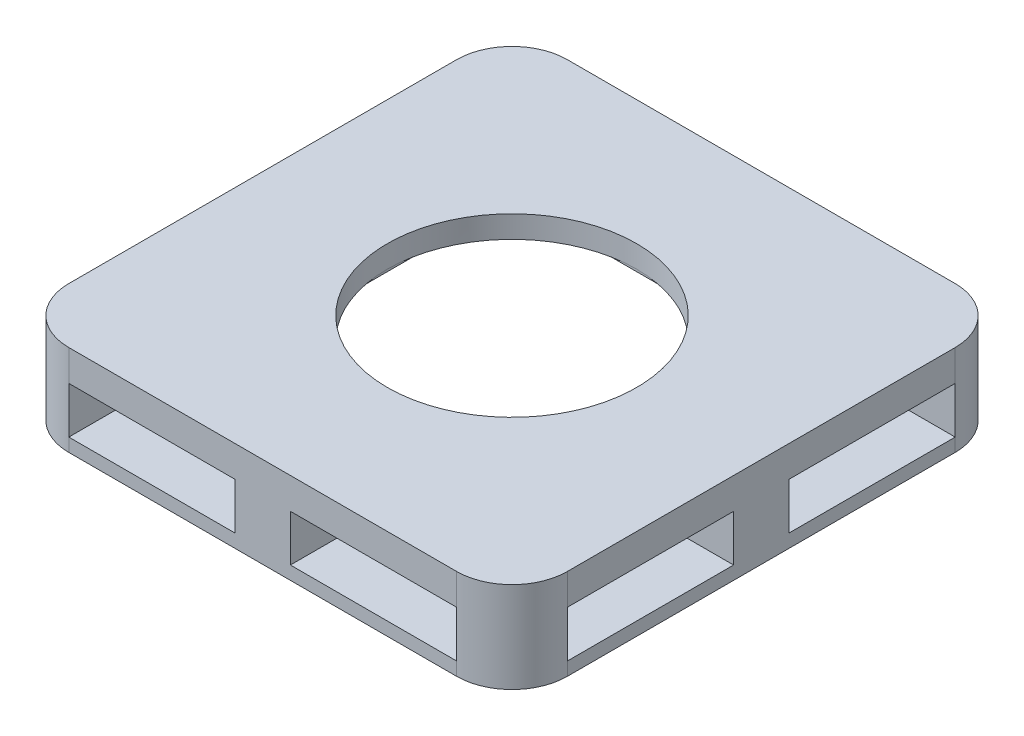
from build123d import *

# Parameters (mm, degrees)
ESBO_O1_W                = 45
ESBO_O1_H                = 45
BASE_DEPTH               = 1.2
ESBO_O2_W                = 5
ESBO_O2_H                = 5
PAREDES_DEPTH            = 5
ESBO_O3_W                = 45
ESBO_O3_H                = 45
TELHADO_DEPTH            = 2
CORTE_DA_BASE_DEPTH      = 2
ESBO_O5_R                = 11.25
CORTE_DO_C_RCULO_DEPTH   = 2
PONTE_1_REACH            = 48.621
ESBO_O6_W                = 5
ESBO_O6_H                = 0.8
PONTE_2_REACH            = 48.621
ESBO_O7_W                = 5
ESBO_O7_H                = 0.8
RESSALTO_EXTRUS_O6_DEPTH = 0.4
RESSALTO_EXTRUS_O7_DEPTH = 0.2
FILETE1_R                = 5
FILETE2_R                = 5
FILETE3_R                = 5
FILETE4_R                = 5


with BuildPart() as part:
    # Esboço1 → Base (new body)
    with BuildSketch(Plane(origin=(0, 0, 0), x_dir=(1, 0, 0), z_dir=(0, 1, 0))):
        Rectangle(ESBO_O1_W, ESBO_O1_H)
    extrude(amount=BASE_DEPTH)

    # Esboço2 → Paredes (add)
    with BuildSketch(Plane(origin=(0, 1.2, 0), x_dir=(1, 0, 0), z_dir=(0, 1, 0))):
        with Locations((-20, 20)):
            Rectangle(ESBO_O2_W, ESBO_O2_H)
        with Locations((20, 20)):
            Rectangle(ESBO_O2_W, ESBO_O2_H)
        with Locations((20, -20)):
            Rectangle(ESBO_O2_W, ESBO_O2_H)
        with Locations((-20, -20)):
            Rectangle(ESBO_O2_W, ESBO_O2_H)
        with Locations((0, 20)):
            Rectangle(ESBO_O2_W, ESBO_O2_H)
        with Locations((-20, 0)):
            Rectangle(ESBO_O2_W, ESBO_O2_H)
        with Locations((20, 0)):
            Rectangle(ESBO_O2_W, ESBO_O2_H)
        with Locations((0, -20)):
            Rectangle(ESBO_O2_W, ESBO_O2_H)
    extrude(amount=PAREDES_DEPTH)

    # Esboço3 → Telhado (add)
    with BuildSketch(Plane(origin=(0, 6.2, 0), x_dir=(1, 0, 0), z_dir=(0, 1, 0))):
        Rectangle(ESBO_O3_W, ESBO_O3_H)
    extrude(amount=TELHADO_DEPTH)

    # Esboço4 → Corte da Base (cut)
    with BuildSketch(Plane(origin=(0, 1.2, 0), x_dir=(1, 0, 0), z_dir=(0, 1, 0))):
        with BuildLine():
            Line((-12.5, 17.5), (12.5, 17.5))
            ThreePointArc((12.5, 17.5), (16.035533906, 16.035533906), (17.5, 12.5))
            Line((17.5, 12.5), (17.5, -12.5))
            ThreePointArc((17.5, -12.5), (16.035533906, -16.035533906), (12.5, -17.5))
            Line((12.5, -17.5), (-12.5, -17.5))
            ThreePointArc((-12.5, -17.5), (-16.035533906, -16.035533906), (-17.5, -12.5))
            Line((-17.5, -12.5), (-17.5, 12.5))
            ThreePointArc((-17.5, 12.5), (-16.035533906, 16.035533906), (-12.5, 17.5))
        make_face()
    extrude(amount=-CORTE_DA_BASE_DEPTH, mode=Mode.SUBTRACT)

    # Esboço5 → Corte do Círculo (cut)
    with BuildSketch(Plane.XZ.offset(-6.2)):
        with Locations(Location((0, 0, 0), (0, 0, 270))):
            Circle(ESBO_O5_R)
    extrude(amount=-CORTE_DO_C_RCULO_DEPTH, mode=Mode.SUBTRACT)

    # Esboço6 → Ponte 1 (add, up to next)
    with BuildSketch(Plane.XY.offset(-17.5), mode=Mode.PRIVATE) as ponte_1_sk1:
        with Locations((20, 5.8)):
            Rectangle(ESBO_O6_W, ESBO_O6_H)
    ponte_1_tool1 = extrude(ponte_1_sk1.sketch, amount=PONTE_1_REACH, mode=Mode.PRIVATE) - part.part
    # Esboço6 → Ponte 1 (add, up to next)
    with BuildSketch(Plane.XY.offset(-17.5), mode=Mode.PRIVATE) as ponte_1_sk2:
        with Locations((-20, 5.8)):
            Rectangle(ESBO_O6_W, ESBO_O6_H)
    ponte_1_tool2 = extrude(ponte_1_sk2.sketch, amount=PONTE_1_REACH, mode=Mode.PRIVATE) - part.part
    add(ponte_1_tool1.solids().sort_by_distance((20, 5.8, -17.5))[0])
    add(ponte_1_tool1.solids().sort_by_distance((20, 5.8, -17.5))[1])
    add(ponte_1_tool2.solids().sort_by_distance((-20, 5.8, -17.5))[0])
    add(ponte_1_tool2.solids().sort_by_distance((-20, 5.8, -17.5))[1])

    # Esboço7 → Ponte 2 (add, up to next)
    with BuildSketch(Plane.ZY.offset(-17.5), mode=Mode.PRIVATE) as ponte_2_sk1:
        with Locations((20, 5.8)):
            Rectangle(ESBO_O7_W, ESBO_O7_H)
    ponte_2_tool1 = extrude(ponte_2_sk1.sketch, amount=PONTE_2_REACH, mode=Mode.PRIVATE) - part.part
    # Esboço7 → Ponte 2 (add, up to next)
    with BuildSketch(Plane.ZY.offset(-17.5), mode=Mode.PRIVATE) as ponte_2_sk2:
        with Locations((-20, 5.8)):
            Rectangle(ESBO_O7_W, ESBO_O7_H)
    ponte_2_tool2 = extrude(ponte_2_sk2.sketch, amount=PONTE_2_REACH, mode=Mode.PRIVATE) - part.part
    add(ponte_2_tool1.solids().sort_by_distance((17.5, 5.8, 20))[0])
    add(ponte_2_tool1.solids().sort_by_distance((17.5, 5.8, 20))[1])
    add(ponte_2_tool2.solids().sort_by_distance((17.5, 5.8, -20))[0])
    add(ponte_2_tool2.solids().sort_by_distance((17.5, 5.8, -20))[1])

    # Esboço8 → Ressalto-extrusão6 (add)
    with BuildSketch(Plane(origin=(0, 6.2, 0), x_dir=(-1, 0, 0), z_dir=(0, -1, 0))):
        Polygon((-2, -17.5), (-17.5, -2), (-17.5, -17.5), align=None)
        Polygon((-17.5, 2), (-17.5, 17.5), (-2, 17.5), align=None)
        Polygon((2, 17.5), (17.5, 17.5), (17.5, 2), align=None)
        Polygon((17.5, -2), (17.5, -17.5), (2, -17.5), align=None)
    extrude(amount=RESSALTO_EXTRUS_O6_DEPTH)

    # Esboço10 → Ressalto-extrusão7 (add)
    with BuildSketch(Plane.XZ.offset(-6.2)):
        Polygon((-11.25, 8.25), (-11.25, -8.25), (-17.5, -2), (-17.5, 2), align=None)
        Polygon((8.25, 11.25), (2, 17.5), (-2, 17.5), (-8.25, 11.25), align=None)
        Polygon((11.25, -8.25), (17.5, -2), (17.5, 2), (11.25, 8.25), align=None)
        Polygon((-8.25, -11.25), (-2, -17.5), (2, -17.5), (8.25, -11.25), align=None)
    extrude(amount=RESSALTO_EXTRUS_O7_DEPTH)

    # Filete1
    filete1_edges = [part.edges().sort_by_distance(p)[0] for p in [
        (-22.5, 4.1, -22.5),
    ]]
    fillet(filete1_edges, radius=FILETE1_R - 0.0001)  # a hair under: the kernel refuses the full size

    # Filete2
    filete2_edges = [part.edges().sort_by_distance(p)[0] for p in [
        (-22.5, 4.1, 22.5),
    ]]
    fillet(filete2_edges, radius=FILETE2_R - 0.0001)  # a hair under: the kernel refuses the full size

    # Filete3
    filete3_edges = [part.edges().sort_by_distance(p)[0] for p in [
        (22.5, 4.1, 22.5),
    ]]
    fillet(filete3_edges, radius=FILETE3_R - 0.0001)  # a hair under: the kernel refuses the full size

    # Filete4
    filete4_edges = [part.edges().sort_by_distance(p)[0] for p in [
        (22.5, 4.1, -22.5),
    ]]
    fillet(filete4_edges, radius=FILETE4_R - 0.0001)  # a hair under: the kernel refuses the full size


solid = part.part
